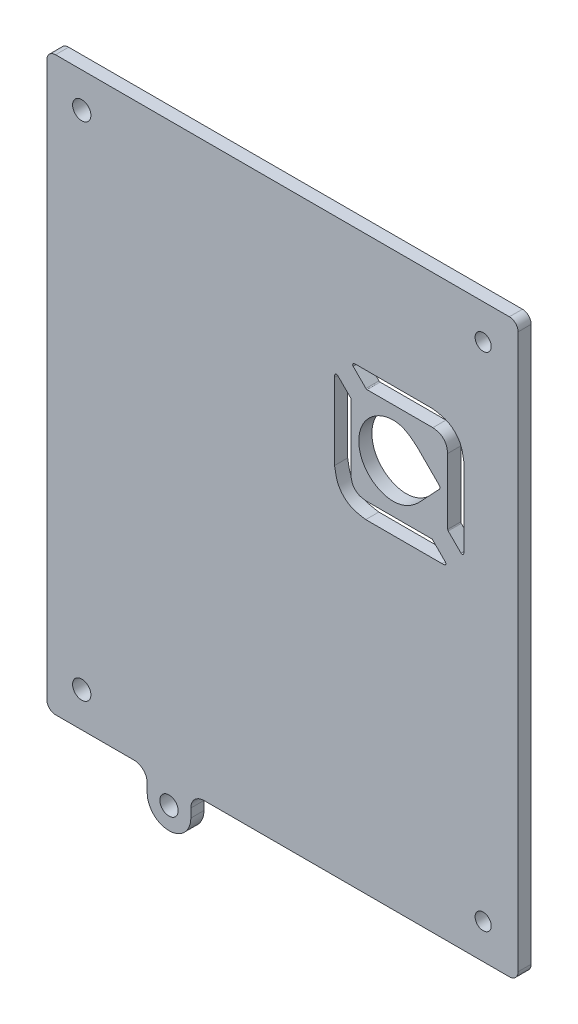
from build123d import *

# Parameters (mm, degrees)
SKETCH2_R           = 2.1
SKETCH2_R_2         = 1.85
BOSS_EXTRUDE1_DEPTH = 3
FILLET1_R           = 2
FILLET2_R           = 3
CUT_EXTRUDE2_DEPTH  = 10


with BuildPart() as part:
    # Sketch2 → Boss-Extrude1 (new body)
    with BuildSketch(Plane.XY):
        with BuildLine():
            Line((0.167188, 159.1806075), (0.167188, 28.18105))
            Line((0.167188, 28.18105), (23.16763175, 28.18105))
            Line((23.16763175, 28.18105), (23.16763175, 23.18105))
            ThreePointArc((23.16763175, 23.18105), (28.16763175, 18.18105), (33.16763175, 23.18105))
            Line((33.16763175, 23.18105), (33.16763175, 28.18105))
            Line((33.16763175, 28.18105), (108.16728925, 28.18105))
            Line((108.16728925, 28.18105), (108.16728925, 159.1806075))
            Line((108.16728925, 159.1806075), (0.167188, 159.1806075))
        make_face()
        with Locations((8.16763175, 151.180160625)):
            Circle(SKETCH2_R, mode=Mode.SUBTRACT)
        with Locations((100.1668405, 151.180160625)):
            Circle(SKETCH2_R_2, mode=Mode.SUBTRACT)
        with Locations((100.1668405, 36.181495)):
            Circle(SKETCH2_R_2, mode=Mode.SUBTRACT)
        with Locations((8.16763175, 36.181495)):
            Circle(SKETCH2_R, mode=Mode.SUBTRACT)
        with Locations((28.16763175, 23.18105)):
            Circle(SKETCH2_R, mode=Mode.SUBTRACT)
    extrude(amount=BOSS_EXTRUDE1_DEPTH)

    # Fillet1
    fillet1_edges = [part.edges().sort_by_distance(p)[0] for p in [
        (0.167188, 159.1806075, 1.5),
        (0.167188, 28.18105, 1.5),
        (108.16728925, 159.1806075, 1.5),
        (108.16728925, 28.18105, 1.5),
    ]]
    fillet(fillet1_edges, radius=FILLET1_R)

    # Fillet2
    fillet2_edges = [part.edges().sort_by_distance(p)[0] for p in [
        (33.16763175, 28.18105, 1.5),
        (23.16763175, 28.18105, 1.5),
    ]]
    fillet(fillet2_edges, radius=FILLET2_R)

    # Sketch4 → Cut-Extrude2 (cut)
    with BuildSketch(Plane.XY.offset(3)):
        with BuildLine():
            Line((90.075646506, 117.73200384), (85.222492213, 122.585440133))
            add(Edge.make_bspline(
                [(85.222492213, 122.585440133), (85.218321654, 122.589906475), (85.210156188, 122.598651052), (85.197690329, 122.611053384), (84.691367809, 123.069531987), (83.646020439, 123.962968104), (81.841639807, 125.063143289), (79.018689145, 125.620925084), (75.483429729, 124.578659546), (72.421413203, 121.511054212), (71.277969143, 117.291105556), (72.419134253, 113.074163455), (75.48745008, 110.019129617), (79.007939308, 109.010493093), (81.802978771, 109.52107185), (83.67661258, 110.4349626), (84.719062278, 111.308613745), (85.222492213, 111.730525843)],
                knots=[0, 0, 0, 0, 0.000489092, 0.000957584, 0.001406885, 0.055155152, 0.111026991, 0.168427122, 0.280644353, 0.389809521, 0.502189722, 0.614354085, 0.723170681, 0.835316449, 0.891384032, 0.947546121, 1, 1, 1, 1], degree=3))
            Line((85.222492213, 111.730525843), (90.075646506, 116.880365543))
            add(Edge.make_bspline(
                [(90.075646506, 116.880365543), (90.109522307, 116.919500688), (90.176474931, 116.996847955), (90.245739585, 117.136575977), (90.255561269, 117.2376526), (90.260467137, 117.288139727)],
                knots=[0, 0, 0, 0, 0.338885039, 0.6697773, 1, 1, 1, 1], degree=3))
            add(Edge.make_bspline(
                [(90.260467137, 117.288139727), (90.255380779, 117.340773367), (90.244905857, 117.449167875), (90.181107379, 117.60340029), (90.110615752, 117.68936083), (90.075646506, 117.73200384)],
                knots=[0, 0, 0, 0, 0.322338023, 0.663827768, 1, 1, 1, 1], degree=3))
        make_face()
        with BuildLine():
            Line((92.042378573, 124.994238315), (92.042378573, 109.915521473))
            add(Edge.make_bspline(
                [(92.042378573, 109.915521473), (92.044053549, 109.893385662), (92.04733714, 109.849991057), (92.055017117, 109.784822745), (92.081026964, 109.735636284), (92.10648293, 109.699656376), (92.129873337, 109.676353608), (92.144989901, 109.662053571), (92.152374353, 109.655067994)],
                knots=[0, 0, 0, 0, 0.227492727, 0.445972237, 0.663373124, 0.787115425, 0.896005733, 1, 1, 1, 1], degree=3))
            Line((92.152374353, 109.655067994), (95.079438499, 106.728110847))
            add(Edge.make_bspline(
                [(95.079438499, 106.728110847), (95.118727147, 106.699140329), (95.197395148, 106.641132409), (95.345587125, 106.617113064), (95.481511773, 106.644351776), (95.59101617, 106.711660969), (95.669918438, 106.802121479), (95.719302497, 106.93509687), (95.751593198, 107.095232125), (95.784904391, 107.280339008), (95.782350487, 107.410685632), (95.783868709, 107.482001637), (95.784493073, 107.494369152), (95.783908787, 107.502602043), (95.783616091, 107.50672629)],
                knots=[0, 0, 0, 0, 0.104345134, 0.208931166, 0.313565445, 0.39799532, 0.482811187, 0.567894079, 0.701186565, 0.836715425, 0.973246641, 0.982162759, 0.991064478, 1, 1, 1, 1], degree=3))
            Line((95.783616091, 107.50672629), (95.783616091, 124.994238315))
            add(Edge.make_bspline(
                [(95.783616091, 124.994238315), (95.584086694, 126.243116762), (95.190094605, 128.709160539), (92.349609853, 131.549706455), (89.883262985, 131.943682776), (88.63409439, 132.143226017)],
                knots=[0, 0, 0, 0, 0.336153842, 0.663771636, 1, 1, 1, 1], degree=3))
            Line((88.63409439, 132.143226017), (71.146969364, 132.14181502))
            add(Edge.make_bspline(
                [(71.146969364, 132.14181502), (71.142987815, 132.142109102), (71.135122968, 132.142690009), (71.123261446, 132.142065086), (71.052056472, 132.140498394), (70.921472626, 132.143536958), (70.7359783, 132.109747899), (70.575108805, 132.07995522), (70.443043183, 132.028445812), (70.352758149, 131.949788373), (70.284752403, 131.840601485), (70.257492158, 131.704360456), (70.281827217, 131.555831375), (70.340541306, 131.477044636), (70.369907918, 131.437638428)],
                knots=[0, 0, 0, 0, 0.008621864, 0.017030969, 0.025643238, 0.162638148, 0.298245388, 0.431901383, 0.516391776, 0.601007159, 0.685956809, 0.790142009, 0.895036806, 1, 1, 1, 1], degree=3))
            Line((70.369907918, 131.437638428), (73.296829064, 128.512061279))
            add(Edge.make_bspline(
                [(73.296829064, 128.512061279), (73.306092343, 128.503116565), (73.324270266, 128.485563782), (73.351278682, 128.458366264), (73.386829102, 128.429677949), (73.435922515, 128.409746043), (73.495180654, 128.400161475), (73.535036078, 128.400439094), (73.555767546, 128.400583502)],
                knots=[0, 0, 0, 0, 0.131285455, 0.257629811, 0.390972346, 0.594165008, 0.788898108, 1, 1, 1, 1], degree=3))
            Line((73.555767546, 128.400583502), (88.63409439, 128.4019945))
            add(Edge.make_bspline(
                [(88.63409439, 128.4019945), (89.238028731, 128.313763765), (90.41836548, 128.141324525), (91.78142027, 126.779337794), (91.954033553, 125.598567235), (92.042378573, 124.994238315)],
                knots=[0, 0, 0, 0, 0.338409749, 0.6613922, 1, 1, 1, 1], degree=3))
        make_face()
        with BuildLine():
            Line((69.847337963, 109.618131067), (69.847337963, 124.696457911))
            add(Edge.make_bspline(
                [(69.847337963, 124.696457911), (69.846606766, 124.715580663), (69.845262861, 124.750727314), (69.836828244, 124.804690792), (69.816482423, 124.848990513), (69.792737862, 124.888973515), (69.766721505, 124.923455444), (69.746447327, 124.945436119), (69.735860186, 124.95691439)],
                knots=[0, 0, 0, 0, 0.196745559, 0.361608386, 0.557261599, 0.692766378, 0.839563136, 1, 1, 1, 1], degree=3))
            Line((69.735860186, 124.95691439), (66.80891404, 127.883869536))
            add(Edge.make_bspline(
                [(66.80891404, 127.883869536), (66.769605831, 127.912840831), (66.690921358, 127.97083358), (66.542755937, 127.994856597), (66.406769595, 127.967678343), (66.297336843, 127.900050886), (66.218676535, 127.809642993), (66.168724076, 127.677154836), (66.136172892, 127.517049928), (66.105902305, 127.331997005), (66.100400952, 127.201446838), (66.105618789, 127.130110403), (66.104985614, 127.117649514), (66.104818107, 127.109384127), (66.104734448, 127.105256093)],
                knots=[0, 0, 0, 0, 0.104384754, 0.208950226, 0.313569176, 0.398093487, 0.483012464, 0.567612364, 0.700915154, 0.836484685, 0.973043492, 0.982112009, 0.991066088, 1, 1, 1, 1], degree=3))
            Line((66.104734448, 127.105256093), (66.104734448, 109.618131067))
            add(Edge.make_bspline(
                [(66.104734448, 109.618131067), (66.304386896, 108.36912039), (66.698639033, 105.902708716), (69.539445064, 103.061623579), (72.006219889, 102.668063373), (73.255483147, 102.468750366)],
                knots=[0, 0, 0, 0, 0.336156644, 0.663805911, 1, 1, 1, 1], degree=3))
            Line((73.255483147, 102.468750366), (90.741266175, 102.470161363))
            add(Edge.make_bspline(
                [(90.741266175, 102.470161363), (90.745400424, 102.469869187), (90.753687265, 102.469283537), (90.766183824, 102.469911254), (90.837616596, 102.471395344), (90.968036679, 102.468853569), (91.153083667, 102.502231259), (91.313154425, 102.534064412), (91.445655261, 102.584070948), (91.536071642, 102.662660234), (91.603669943, 102.772096559), (91.630864971, 102.908121224), (91.606519865, 103.056589074), (91.547834053, 103.135072694), (91.518470621, 103.174341955)],
                knots=[0, 0, 0, 0, 0.008953482, 0.017946692, 0.027021307, 0.163490993, 0.298949058, 0.432165007, 0.516776033, 0.601601228, 0.686034701, 0.790672378, 0.895262972, 1, 1, 1, 1], degree=3))
            Line((91.518470621, 103.174341955), (88.591512475, 106.101262101))
            add(Edge.make_bspline(
                [(88.591512475, 106.101262101), (88.582314074, 106.110851525), (88.564206713, 106.129728628), (88.536403468, 106.158293472), (88.503161408, 106.188740878), (88.453710549, 106.205539256), (88.395147079, 106.210160236), (88.354296426, 106.21094735), (88.332574993, 106.211365881)],
                knots=[0, 0, 0, 0, 0.134581529, 0.264928249, 0.404990742, 0.58604785, 0.779890073, 1, 1, 1, 1], degree=3))
            Line((88.332574993, 106.211365881), (73.255483147, 106.210236883))
            add(Edge.make_bspline(
                [(73.255483147, 106.210236883), (72.651391524, 106.298170044), (71.470770397, 106.470024352), (70.108075627, 107.832856289), (69.935611441, 109.013721212), (69.847337963, 109.618131067)],
                knots=[0, 0, 0, 0, 0.33840601, 0.661371999, 1, 1, 1, 1], degree=3))
        make_face()
    extrude(amount=-CUT_EXTRUDE2_DEPTH, mode=Mode.SUBTRACT)


solid = part.part
